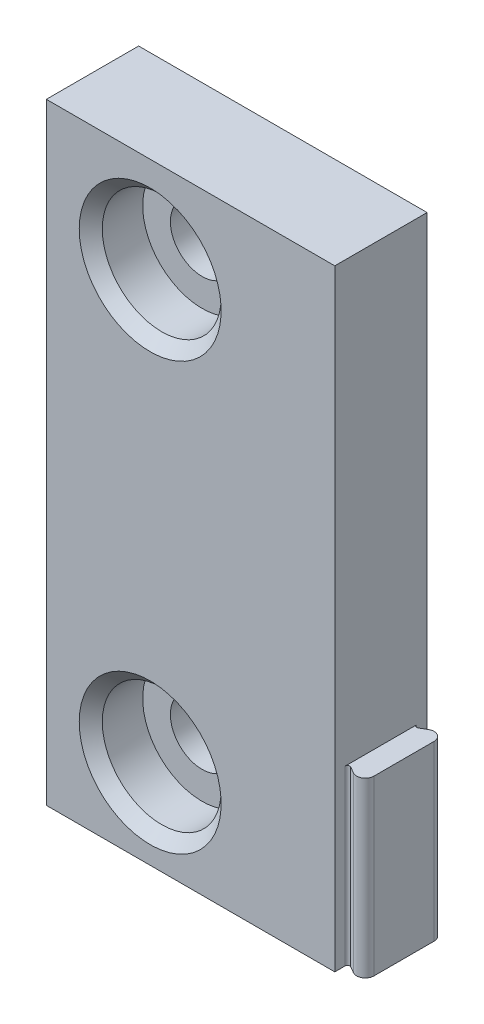
from build123d import *

# Parameters (mm, degrees)
SKETCH2_W           = 25
SKETCH2_H           = 53
SKETCH2_R           = 2.75
BOSS_EXTRUDE1_DEPTH = 8
BOSS_EXTRUDE2_DEPTH = 15
SKETCH4_R           = 5.15
CUT_EXTRUDE1_DEPTH  = 4.5
CHAMFER1_SIZE       = 1
FILLET1_R           = 0.75
FILLET3_R           = 0.2


with BuildPart() as part:
    # Sketch2 → Boss-Extrude1 (new body)
    with BuildSketch(Plane.XY):
        with Locations((12.5, 26.5)):
            Rectangle(SKETCH2_W, SKETCH2_H)
        with Locations((9, 44.7)):
            Circle(SKETCH2_R, mode=Mode.SUBTRACT)
        with Locations((9, 7.7)):
            Circle(SKETCH2_R, mode=Mode.SUBTRACT)
    extrude(amount=BOSS_EXTRUDE1_DEPTH)

    # Sketch3 → Boss-Extrude2 (add)
    with BuildSketch(Plane.XZ):
        Polygon((25, 1.25), (27, 0.095299462), (27, 7.904700538), (25, 6.75), align=None)
    extrude(amount=-BOSS_EXTRUDE2_DEPTH)

    # Sketch4 → Cut-Extrude1 (cut)
    with BuildSketch(Plane.XY.offset(8)):
        with Locations((9, 44.7)):
            Circle(SKETCH4_R)
        with Locations((9, 7.7)):
            Circle(SKETCH4_R)
    extrude(amount=-CUT_EXTRUDE1_DEPTH, mode=Mode.SUBTRACT)

    # Chamfer1
    chamfer1_edges = [part.edges().sort_by_distance(p)[0] for p in [
        (3.85, 44.7, 8),
        (3.85, 7.7, 8),
    ]]
    chamfer(chamfer1_edges, length=CHAMFER1_SIZE)

    # Fillet1
    fillet1_edges = [part.edges().sort_by_distance(p)[0] for p in [
        (27, 7.5, 0.095299462),
        (27, 7.5, 7.904700538),
    ]]
    fillet(fillet1_edges, radius=FILLET1_R)

    # Fillet3
    fillet3_edges = [part.edges().sort_by_distance(p)[0] for p in [
        (25, 7.5, 6.75),
        (25, 7.5, 1.25),
    ]]
    fillet(fillet3_edges, radius=FILLET3_R)


solid = part.part
